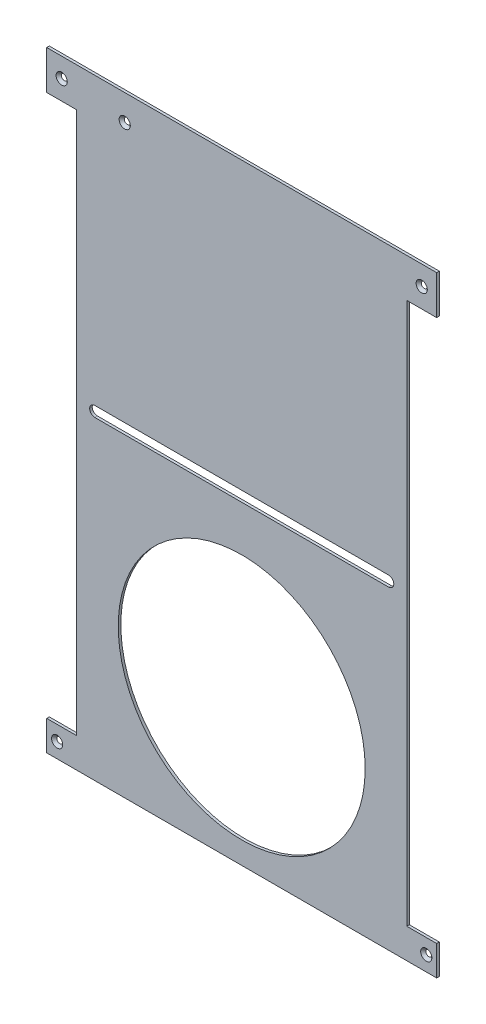
from build123d import *

# Parameters (mm, degrees)
AUFSATZ_LINEAR_AUSTRAGEN1_DEPTH                      = 2
FORMSENKUNG_F_R_M4_SENKSCHRAUBE_MIT_INNE_D           = 4.5
FORMSENKUNG_F_R_M4_SENKSCHRAUBE_MIT_INNE_DEPTH       = 15
FORMSENKUNG_F_R_M4_SENKSCHRAUBE_MIT_INNE_CSINK_D     = 8.6
FORMSENKUNG_F_R_M4_SENKSCHRAUBE_MIT_INNE_CSINK_ANGLE = 90
FORMSENKUNG_F_R_M4_SENKSCHRAUBE_MIT_INNE_TIP         = 1.351936393
SKIZZE4_R                                            = 95
SCHNITT_LINEAR_AUSTRAGEN1_DEPTH                      = 10
ERDUNG_AT_2_COUNT                                    = 2
ERDUNG_AT_2_PITCH                                    = 204.963132201
SKIZZE7_W                                            = 234
SKIZZE7_H                                            = 8
SCHNITT_LINEAR_AUSTRAGEN2_DEPTH                      = 10
VERRUNDUNG1_R                                        = 4


with BuildPart() as part:
    # Skizze1 → Aufsatz-Linear austragen1 (new body)
    with BuildSketch(Plane.XY):
        Polygon((0, 0), (300, 0), (300, 23), (277, 23), (277, 440), (300, 440), (300, 470), (0, 470), (0, 440), (23, 440), (23, 23), (0, 23), align=None)
    extrude(amount=AUFSATZ_LINEAR_AUSTRAGEN1_DEPTH)

    # Formsenkung für M4 Senkschraube mit Innensechskant1
    with Locations(Plane.XY.offset(2)):
        with Locations((292, 11.5), (8, 11.5), (11.5, 455), (288.5, 455)):
            CounterSinkHole(FORMSENKUNG_F_R_M4_SENKSCHRAUBE_MIT_INNE_D / 2, FORMSENKUNG_F_R_M4_SENKSCHRAUBE_MIT_INNE_CSINK_D / 2, depth=FORMSENKUNG_F_R_M4_SENKSCHRAUBE_MIT_INNE_DEPTH, counter_sink_angle=FORMSENKUNG_F_R_M4_SENKSCHRAUBE_MIT_INNE_CSINK_ANGLE)
            with Locations((0, 0, -(FORMSENKUNG_F_R_M4_SENKSCHRAUBE_MIT_INNE_DEPTH + FORMSENKUNG_F_R_M4_SENKSCHRAUBE_MIT_INNE_TIP / 2))):  # 118° drill point
                Cone(0, FORMSENKUNG_F_R_M4_SENKSCHRAUBE_MIT_INNE_D / 2, FORMSENKUNG_F_R_M4_SENKSCHRAUBE_MIT_INNE_TIP, mode=Mode.SUBTRACT)

    # Skizze4 → Schnitt-Linear austragen1 (cut)
    with BuildSketch(Plane.XY.offset(2)):
        with Locations((150, 112)):
            Circle(SKIZZE4_R)
    extrude(amount=-SCHNITT_LINEAR_AUSTRAGEN1_DEPTH, mode=Mode.SUBTRACT)

    # Skizze6 → Erdung (revolve, cut)
    with BuildSketch(Plane(origin=(60, 450, 2), x_dir=(0, -1, 0), z_dir=(1, 0, 0))):
        Polygon((0, 0), (0, 2), (2.25, 2), (2.25, 2.05), (4.3, 0), align=None)
    erdung = revolve(axis=Axis((60, 450, 8.35), (0, 0, -1)), mode=Mode.SUBTRACT)

    # Erdung at 2: Erdung ×2
    with Locations(*[Vector(-0.17833221510322264, 0.9839703354554842, 0) * (i * ERDUNG_AT_2_PITCH) for i in range(1, ERDUNG_AT_2_COUNT)]):
        add(erdung, mode=Mode.SUBTRACT)

    # Skizze7 → Schnitt-Linear austragen2 (cut)
    with BuildSketch(Plane(origin=(0, 0, 0), x_dir=(-1, 0, 0), z_dir=(0, 0, -1))):
        with Locations((-150, 246)):
            Rectangle(SKIZZE7_W, SKIZZE7_H)
    extrude(amount=-SCHNITT_LINEAR_AUSTRAGEN2_DEPTH, mode=Mode.SUBTRACT)

    # Verrundung1
    verrundung1_edges = [part.edges().sort_by_distance(p)[0] for p in [
        (33, 242, 1),
        (33, 250, 1),
        (267, 242, 1),
        (267, 250, 1),
    ]]
    fillet(verrundung1_edges, radius=VERRUNDUNG1_R - 0.0001)  # a hair under: the kernel refuses the full size


solid = part.part
